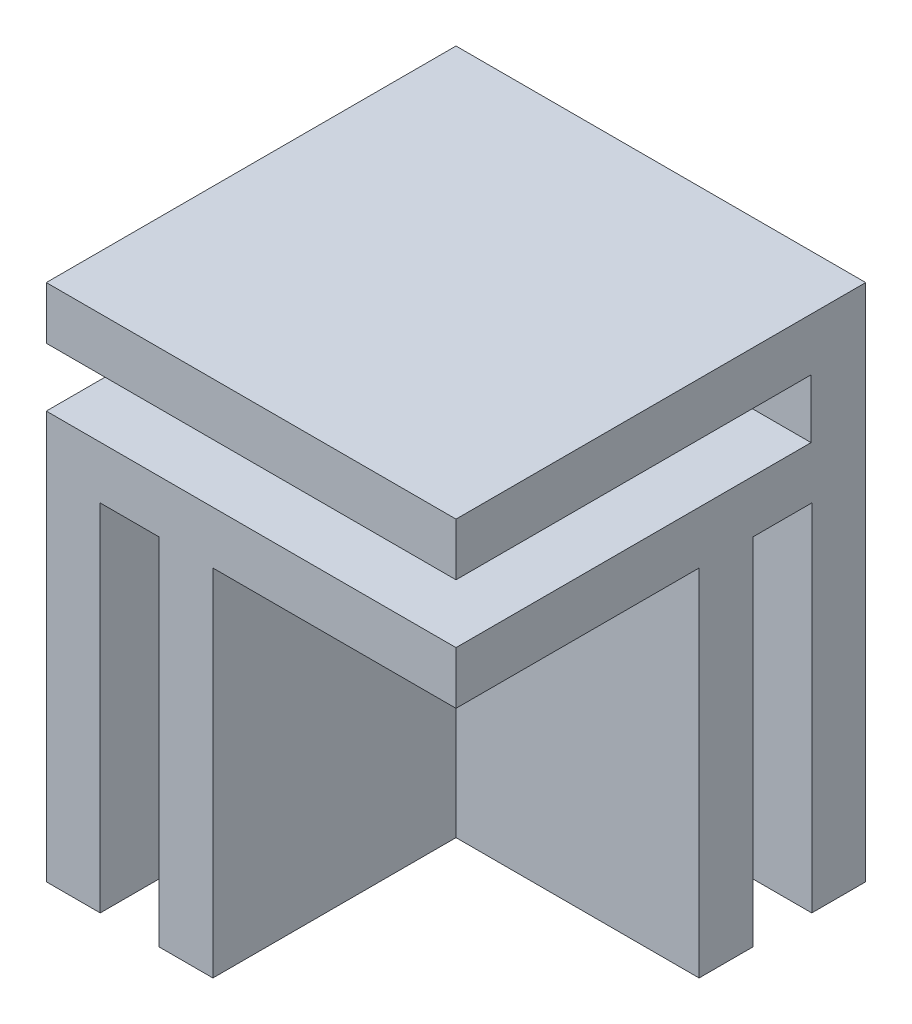
from build123d import *

# Parameters (mm, degrees)
ESQUISSE1_W             = 30
ESQUISSE1_H             = 30
BOSS_EXTRU_1_DEPTH      = 38
ESQUISSE2_W             = 17.8
ESQUISSE2_H             = 4.3
ESQUISSE2_W_2           = 4.3
ESQUISSE2_H_2           = 17.8
ENL_V_MAT_EXTRU_1_DEPTH = 26
ESQUISSE5_W             = 26
ESQUISSE5_H             = 4.3
ENL_V_MAT_EXTRU_4_DEPTH = 52.13914869


with BuildPart() as part:
    # Esquisse1 → Boss.-Extru.1 (new body)
    with BuildSketch(Plane(origin=(0, 0, 0), x_dir=(1, 0, 0), z_dir=(0, 1, 0))):
        with Locations((-20.886738322, -1.468531469)):
            Rectangle(ESQUISSE1_W, ESQUISSE1_H)
    extrude(amount=BOSS_EXTRU_1_DEPTH)

    # Esquisse2 → Enlèv. mat.-Extru.1 (cut)
    with BuildSketch(Plane.XZ):
        with Locations((-14.786738322, -7.431468531)):
            Rectangle(ESQUISSE2_W, ESQUISSE2_H)
        with Locations((-29.786738322, 7.568531469)):
            Rectangle(ESQUISSE2_W_2, ESQUISSE2_H_2)
        with Locations((-14.786738322, 7.568531469)):
            Rectangle(ESQUISSE2_W, ESQUISSE2_H_2)
    extrude(amount=-ENL_V_MAT_EXTRU_1_DEPTH, mode=Mode.SUBTRACT)

    # Esquisse5 → Enlèv. mat.-Extru.4 (cut, through all)
    with BuildSketch(Plane.ZY.offset(35.886738322)):
        with Locations((3.468531469, 32)):
            Rectangle(ESQUISSE5_W, ESQUISSE5_H)
    extrude(amount=-ENL_V_MAT_EXTRU_4_DEPTH, mode=Mode.SUBTRACT)


solid = part.part
